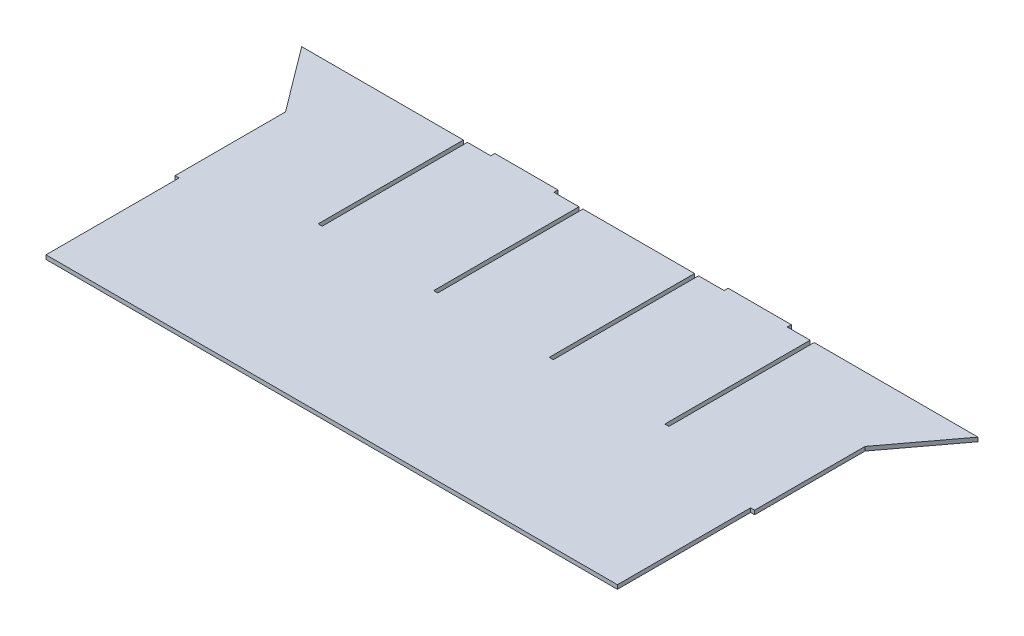
from build123d import *

# Parameters (mm, degrees)
SKETCH1_W           = 455.9320066
SKETCH1_H           = 3.175
BOSS_EXTRUDE1_DEPTH = 242.425000036
SKETCH2_W           = 3.175
SKETCH2_H           = 114.3
CUT_EXTRUDE1_DEPTH  = 333.788911967
LPATTERN1_COUNT     = 4
LPATTERN1_PITCH     = 90.932
SKETCH3_W           = 49.658811606
SKETCH3_H           = 3.175
BOSS_EXTRUDE2_DEPTH = 3.175
BOSS_EXTRUDE3_DEPTH = 3.175
SKETCH5_W           = 3.175
SKETCH5_H           = 104.775
CUT_EXTRUDE2_DEPTH  = 3.175


with BuildPart() as part:
    # Sketch1 → Boss-Extrude1 (new body)
    with BuildSketch(Plane.XY):
        Rectangle(SKETCH1_W, SKETCH1_H)
    extrude(amount=BOSS_EXTRUDE1_DEPTH)

    # Sketch2 → Cut-Extrude1 (cut, through all)
    with BuildSketch(Plane(origin=(0, 1.5875, 0), x_dir=(1, 0, 0), z_dir=(0, 1, 0))):
        with Locations((135.5735033, -57.15)):
            Rectangle(SKETCH2_W, SKETCH2_H)
    cut_extrude1 = extrude(amount=-CUT_EXTRUDE1_DEPTH, mode=Mode.SUBTRACT)

    # LPattern1: Cut-Extrude1 ×4
    with Locations(*[(-i * LPATTERN1_PITCH, 0, 0) for i in range(1, LPATTERN1_COUNT)]):
        add(cut_extrude1, mode=Mode.SUBTRACT)

    # Sketch3 → Boss-Extrude2 (add)
    with BuildSketch(Plane(origin=(0, 0, 0), x_dir=(-1, 0, 0), z_dir=(0, 0, -1))):
        with Locations((-91.136597497, 0)):
            Rectangle(SKETCH3_W, SKETCH3_H)
        with Locations((92.427590897, 0)):
            Rectangle(SKETCH3_W, SKETCH3_H)
    extrude(amount=BOSS_EXTRUDE2_DEPTH)

    # Sketch4 → Boss-Extrude3 (add)
    with BuildSketch(Plane.XZ.offset(1.5875)):
        Polygon((-227.9660033, 0), (-266.0660033, 0), (-227.9660033, 50.8), align=None)
    boss_extrude3 = extrude(amount=-BOSS_EXTRUDE3_DEPTH)

    # Mirror1: Boss-Extrude3 across plane
    add(boss_extrude3.mirror(Plane(origin=(0, 0, 0), x_dir=(0, 0, 1), z_dir=(1, 0, 0))))

    # Sketch5 → Cut-Extrude2 (cut)
    with BuildSketch(Plane.XZ.offset(1.5875)):
        with Locations((-226.3785033, 190.037500036)):
            Rectangle(SKETCH5_W, SKETCH5_H)
    cut_extrude2 = extrude(amount=-CUT_EXTRUDE2_DEPTH, mode=Mode.SUBTRACT)

    # Mirror2: Cut-Extrude2 across plane
    add(cut_extrude2.mirror(Plane(origin=(0, 0, 0), x_dir=(0, 0, 1), z_dir=(1, 0, 0))), mode=Mode.SUBTRACT)


solid = part.part
